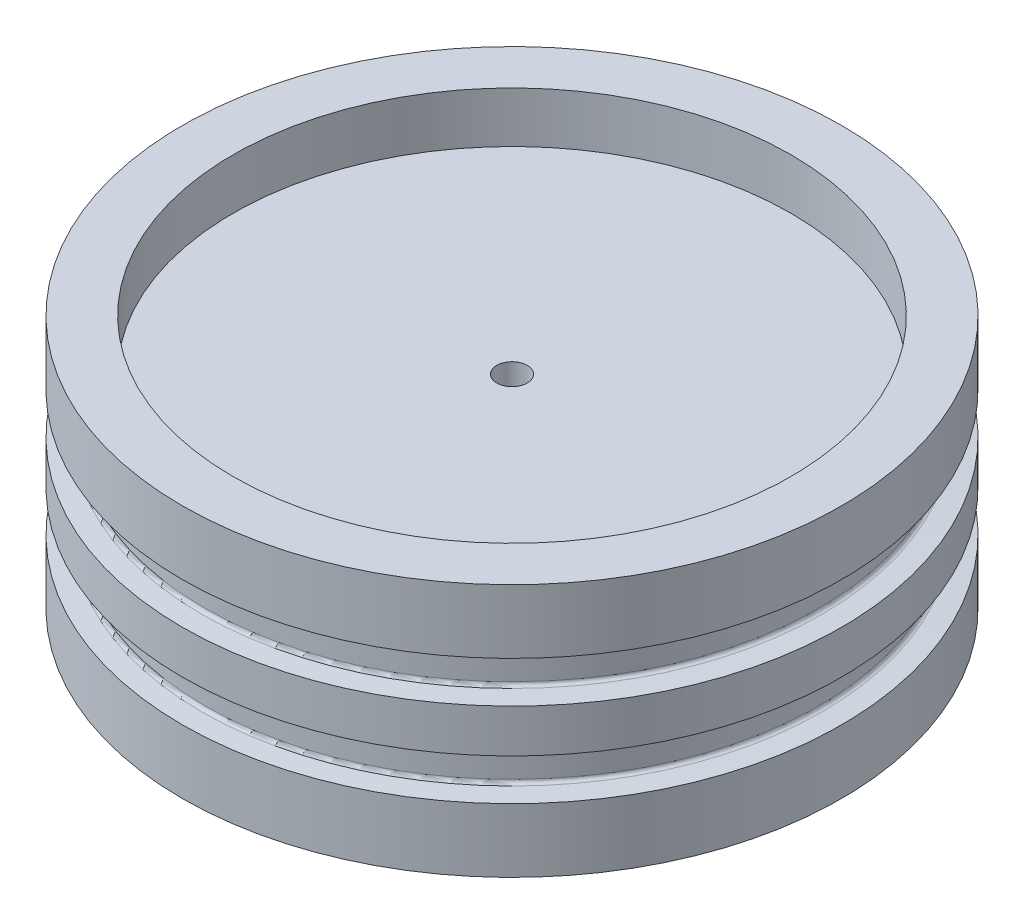
from build123d import *

# Parameters (mm, degrees)
LPATTERN2_COUNT = 2
LPATTERN2_PITCH = 10.583333333


with BuildPart() as part:
    # Sketch1 → Revolve1 (revolve)
    with BuildSketch(Plane.XY):
        Polygon((-41.275, 12.7), (-41.275, 44.45), (-34.925, 44.45), (-34.925, 38.1), (-1.91325754, 38.1), (-1.91325754, 0), (-6.35, 0), (-6.35, 12.7), align=None)
    revolve(axis=Axis((0, 0, 0), (0, 1, 0)))

    # Sketch15 → Groove for AS 568-234, O-Ring1 (revolve, cut)
    with BuildSketch(Plane(origin=(0, 0, 0), x_dir=(0, 0, -1), z_dir=(-1, 0, 0))):
        with BuildLine():
            Line((38.861359272, -31.491766667), (41.3639, -31.272822723))
            Line((41.3639, -31.272822723), (41.3639, -36.46051061))
            Line((41.3639, -36.46051061), (38.861359272, -36.241566667))
            ThreePointArc((38.861359272, -36.241566667), (38.572380224, -36.099057971), (38.4556, -35.798758123))
            Line((38.4556, -35.798758123), (38.4556, -31.93457521))
            ThreePointArc((38.4556, -31.93457521), (38.572380224, -31.634275363), (38.861359272, -31.491766667))
        make_face()
    groove_for_as_568_234_o_ring1 = revolve(axis=Axis((0, -50, 0), (0, 1, 0)), mode=Mode.SUBTRACT)

    # LPattern2: Groove for AS 568-234, O-Ring1 ×2
    with Locations(*[(0, -i * LPATTERN2_PITCH, 0) for i in range(1, LPATTERN2_COUNT)]):
        add(groove_for_as_568_234_o_ring1, mode=Mode.SUBTRACT)


solid = part.part
